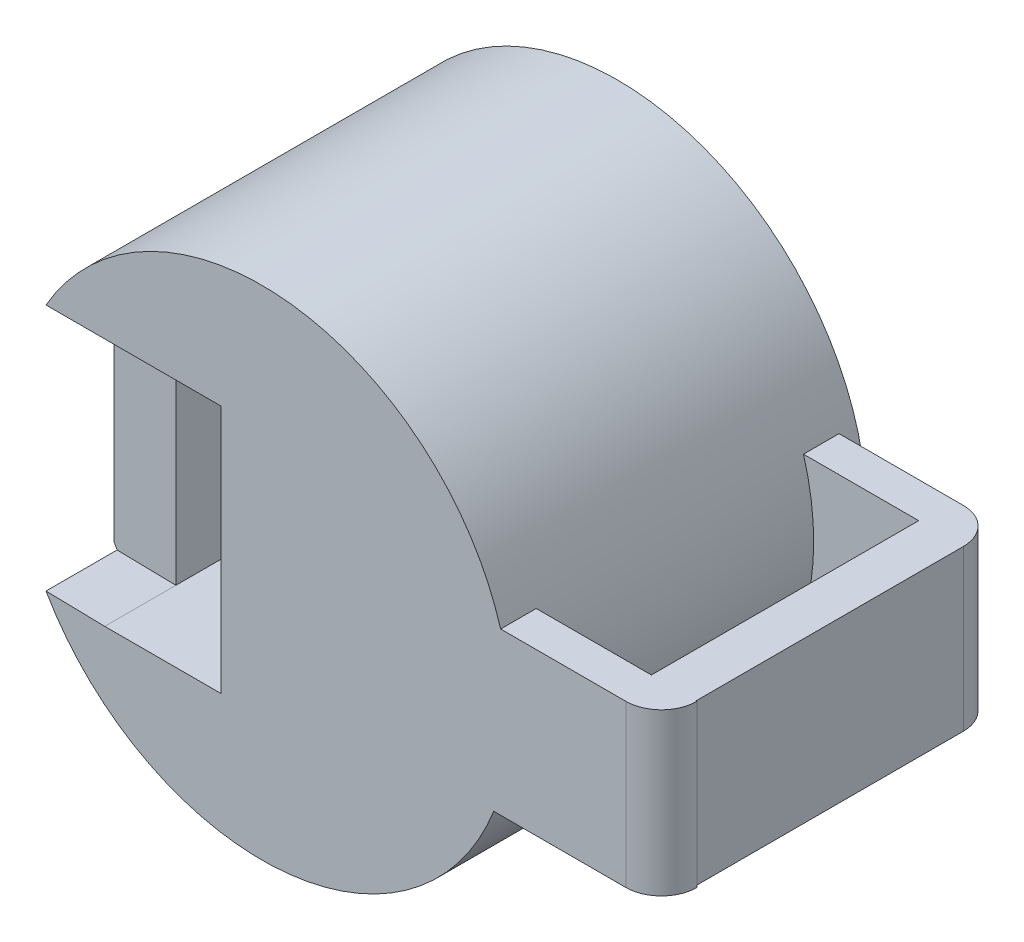
from build123d import *

# Parameters (mm, degrees)
SKETCH_1_R          = 7
EXTRUDE_1_DEPTH     = 10
SKETCH_9_W          = 5.615402883
SKETCH_9_H          = 4.534999238
EXTRUDE_6_DEPTH     = 1
SKETCH_11_W         = 1.257653538
SKETCH_11_H         = 9
EXTRUDE_7_DEPTH     = 4.5
EXTRUDE_8_DEPTH     = 6
FILLET_8_R          = 1
FILLET_9_R          = 1
SKETCH_14_W         = 3.266646727
SKETCH_14_H         = 7
CUT_EXTRUDE_1_DEPTH = 10
CUT_EXTRUDE_START   = -2
CUT_EXTRUDE_2_DEPTH = 2
CUT_EXTRUDE_3_DEPTH = 2
SKETCH_17_W         = 6
SKETCH_17_H         = 6.96519698
CUT_EXTRUDE_5_DEPTH = 2


with BuildPart() as part:
    # 草圖1 → 填料-伸長1 (new body)
    with BuildSketch(Plane(origin=(0.382706605, 0, 0), x_dir=(1, 0, 0), z_dir=(0, 0, 1))):
        with Locations((-75.594417438, 2.55)):
            Circle(SKETCH_1_R)
    extrude(amount=EXTRUDE_1_DEPTH)

    # 草圖9 → 填料-伸長6 (add)
    with BuildSketch(Plane(origin=(8.106794936, 0, 9), x_dir=(1, 0, 0), z_dir=(0, 0, 1))):
        with Locations((-74.892231202, 2.267499619)):
            Rectangle(SKETCH_9_W, SKETCH_9_H)
    extrude(amount=EXTRUDE_6_DEPTH)



with BuildPart() as body_2:
    # 草圖11 → 填料-伸長7 (new body)
    with BuildSketch(Plane(origin=(11.553490323, 4.534999238, 0.48426017), x_dir=(1, 0, 0), z_dir=(0, 1, 0))):
        with Locations((-76.184774061, -4.5)):
            Rectangle(SKETCH_11_W, SKETCH_11_H)
    extrude(amount=-EXTRUDE_7_DEPTH)


with BuildPart() as part_1:
    add(part.part)

    add(body_2.part)  # 填料-伸長8 merges body 2
    # 草圖12 → 填料-伸長8 (add)
    with BuildSketch(Plane.ZY.offset(65.260110507)):
        Polygon((0.48426017, 4.534999238), (0.48426017, 0), (1.483647509, 0.034999238), (1.483647509, 4.534999238), align=None)
    extrude(amount=EXTRUDE_8_DEPTH)

    # 圓角8
    fillet_8_edges = [part_1.edges().sort_by_distance(p)[0] for p in [
        (-64.002456969, 2.284999238, 0.48426017),
    ]]
    fillet(fillet_8_edges, radius=FILLET_8_R)

    # 圓角9
    fillet_9_edges = [part_1.edges().sort_by_distance(p)[0] for p in [
        (-63.977734824, 2.267499619, 10),
    ]]
    fillet(fillet_9_edges, radius=FILLET_9_R - 0.0001)  # a hair under: the kernel refuses the full size

    # 草圖14 → 除料-伸長1 (cut)
    with BuildSketch(Plane.XY.offset(10)):
        with Locations((-77.998959421, 2.53259849)):
            Rectangle(SKETCH_14_W, SKETCH_14_H)
    extrude(amount=-CUT_EXTRUDE_1_DEPTH, mode=Mode.SUBTRACT)

    # 草圖15 → 除料-伸長2 (cut)
    with BuildSketch(Plane.XY.offset(10).offset(CUT_EXTRUDE_START)):
        with BuildLine():
            Line((-79.632282784, 6.03259849), (-81.28390218, 6.03259849))
            ThreePointArc((-81.28390218, 6.03259849), (-82.211710833, 2.55), (-81.28390218, -0.93259849))
            Line((-81.28390218, -0.93259849), (-79.632282784, -0.96740151))
            Line((-79.632282784, -0.96740151), (-79.632282784, 6.03259849))
        make_face()
    extrude(amount=CUT_EXTRUDE_2_DEPTH, mode=Mode.SUBTRACT)

    # 草圖16 → 除料-伸長3 (cut)
    with BuildSketch(Plane(origin=(0, 0, 0), x_dir=(-1, 0, 0), z_dir=(0, 0, -1))):
        with BuildLine():
            Line((79.632282784, 6.03259849), (81.28390218, 6.03259849))
            ThreePointArc((81.28390218, 6.03259849), (82.211710833, 2.55), (81.28390218, -0.93259849))
            Line((81.28390218, -0.93259849), (79.632282784, -0.96740151))
            Line((79.632282784, -0.96740151), (79.632282784, 6.03259849))
        make_face()
    extrude(amount=-CUT_EXTRUDE_3_DEPTH, mode=Mode.SUBTRACT)

    # 草圖17 → 除料-伸長5 (cut)
    with BuildSketch(Plane.ZY.offset(83.365636057)):
        with Locations((5, 2.55)):
            Rectangle(SKETCH_17_W, SKETCH_17_H)
    extrude(amount=-CUT_EXTRUDE_5_DEPTH, mode=Mode.SUBTRACT)


solid = part_1.part
